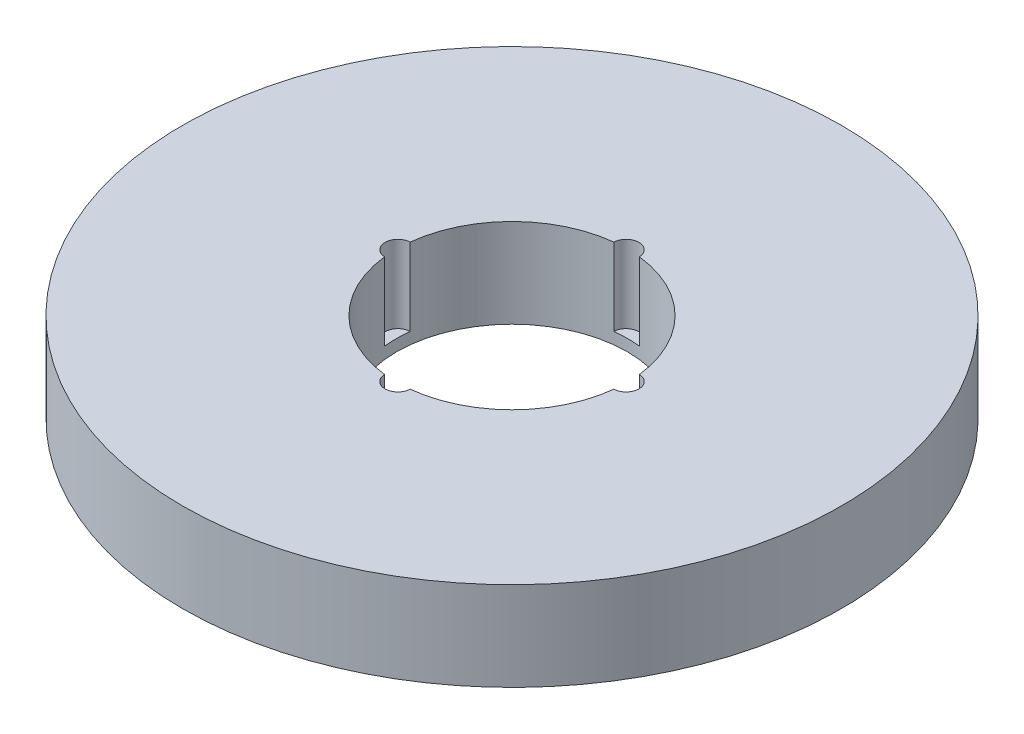
from build123d import *

# Parameters (mm, degrees)
SKETCH1_R           = 100
BOSS_EXTRUDE1_DEPTH = 27
SKETCH2_R           = 35
CUT_EXTRUDE1_DEPTH  = 144.975692393
SKETCH3_R           = 3.87281734
CUT_EXTRUDE2_DEPTH  = 23.482064542
CIRPATTERN1_COUNT   = 4


with BuildPart() as part:
    # Sketch1 → Boss-Extrude1 (new body)
    with BuildSketch(Plane(origin=(0, 0, 0), x_dir=(1, 0, 0), z_dir=(0, 1, 0))):
        Circle(SKETCH1_R)
    extrude(amount=BOSS_EXTRUDE1_DEPTH)

    # Sketch2 → Cut-Extrude1 (cut, through all)
    with BuildSketch(Plane(origin=(0, 0, 0), x_dir=(1, 0, 0), z_dir=(0, 1, 0))):
        Circle(SKETCH2_R)
    extrude(amount=CUT_EXTRUDE1_DEPTH, mode=Mode.SUBTRACT)

    # Sketch3 → Cut-Extrude2 (cut)
    with BuildSketch(Plane(origin=(0, 27, 0), x_dir=(1, 0, 0), z_dir=(0, 1, 0))):
        with Locations((-34.643895565, 0)):
            Circle(SKETCH3_R)
    cut_extrude2 = extrude(amount=-CUT_EXTRUDE2_DEPTH, mode=Mode.SUBTRACT)

    # CirPattern1: Cut-Extrude2 ×4 about axis
    cirpattern1_axis = Axis((0, 0, 0), (0, 1, 0))
    for i in range(1, CIRPATTERN1_COUNT):
        add(cut_extrude2.rotate(cirpattern1_axis, i * 360 / CIRPATTERN1_COUNT), mode=Mode.SUBTRACT)


solid = part.part
